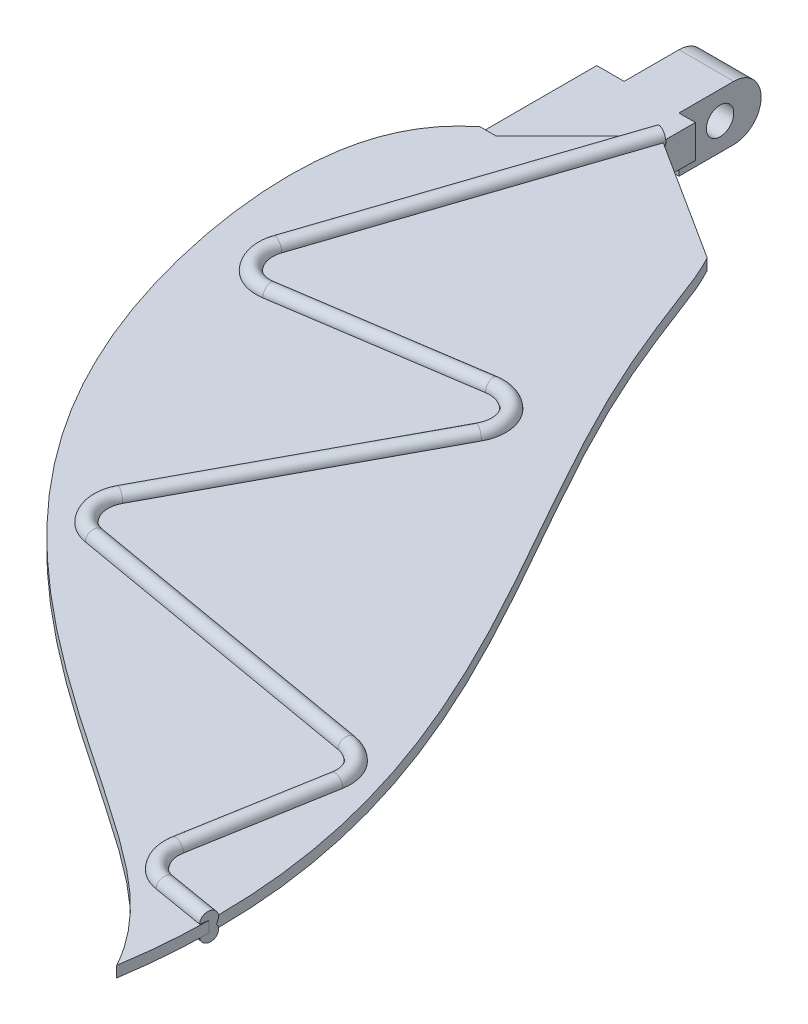
from build123d import *
from build123d.topology import SkipClean

# Parameters (mm, degrees)
SKETCH1_W           = 10
SKETCH1_H           = 15
BOSS_EXTRUDE1_DEPTH = 10
SKETCH2_R           = 2.5
CUT_EXTRUDE1_DEPTH  = 10
FILLET1_R           = 5
BOSS_EXTRUDE2_DEPTH = 6
CHAMFER1_SIZE       = 15
THICKEN2_START      = 9
THICKEN2_DEPTH      = 2
SWEEP1_PROFILE_R    = 1.5
SKETCH30_R          = 1
CUT_EXTRUDE2_DEPTH  = 6


# Read off the part's stored shape, not the designer's step: Thicken2
with BuildPart() as part:
    # Sketch1 → Boss-Extrude1 (new body)
    with BuildSketch(Plane(origin=(0, 0, 0), x_dir=(1, 0, 0), z_dir=(0, 1, 0))):
        Rectangle(SKETCH1_W, SKETCH1_H)
    extrude(amount=BOSS_EXTRUDE1_DEPTH)

    # Sketch2 → Cut-Extrude1 (cut)
    with BuildSketch(Plane(origin=(5, 0, 0), x_dir=(0, 0, -1), z_dir=(1, 0, 0))):
        with Locations((0, 5)):
            Circle(SKETCH2_R)
    extrude(amount=-CUT_EXTRUDE1_DEPTH, mode=Mode.SUBTRACT)

    # Fillet1
    fillet1_edges = [part.edges().sort_by_distance(p)[0] for p in [
        (0, 0, -7.5),
        (0, 10, -7.5),
    ]]
    fillet(fillet1_edges, radius=FILLET1_R - 0.0001)  # a hair under: the kernel refuses the full size

    # Sketch3 → Boss-Extrude2 (add)
    with BuildSketch(Plane(origin=(0, 10, 0), x_dir=(1, 0, 0), z_dir=(0, 1, 0))):
        Polygon((-5, -7.5), (-10, -7.5), (-10, -28.828934271), (7.994714039, -28.828934271), (7.994714039, -7.5), (5, -7.5), (0, -7.5), align=None)
    extrude(amount=-BOSS_EXTRUDE2_DEPTH)

    # Chamfer1
    chamfer1_edges = [part.edges().sort_by_distance(p)[0] for p in [
        (7.994714039, 7, 28.828934271),
    ]]
    chamfer(chamfer1_edges, length=CHAMFER1_SIZE)

    # Thicken2 outline → Thicken2 (add)
    with BuildSketch(Plane(origin=(0, 0, 0), x_dir=(1, 0, 0), z_dir=(0, 1, 0)).offset(THICKEN2_START)):
        with BuildLine():
            Line((-7.005285961, -28.828934271), (-10, -28.828934271))
            add(Edge.make_bspline(
                [(-10, -28.828934271), (-25.805548542, -41.548642671), (-25.805548542, -64.274187613), (-8.502642981, -101.403246954), (-13.322502729, -124.128791895), (10.043198408, -146.534258739), (71.49819318, -165.418866507), (71.49819318, -177.90191232), (81.740692308, -180.462537103), (89.422566655, -194.545973404)],
                knots=[0, 0, 0, 0, 0, 0, 0, 0, 0, 0, 1, 1, 1, 1, 1, 1, 1, 1, 1, 1], degree=9))
            add(Edge.make_bspline(
                [(89.422566655, -194.545973404), (100.945378174, -121.248089016), (40.770695794, -78.677702012), (40.770695794, -46.02973604), (31.488430959, -28.828934271)],
                knots=[0, 0, 0, 0, 0, 1, 1, 1, 1, 1], degree=4))
            Line((31.488430959, -28.828934271), (7.994714039, -13.828934271))
            Line((7.994714039, -13.828934271), (-7.005285961, -28.828934271))
        make_face()
    extrude(amount=THICKEN2_DEPTH)

    # Sweep1: sweep along a path in Sketch5
    with BuildLine(Plane.XZ.offset(-9)) as sweep1_path:
        Line((7.994714039, 13.828934271), (-9.559839963, 66.388364513))
        ThreePointArc((-9.559839963, 66.388364513), (-8.460678772, 72.151148401), (-2.971514318, 74.221633139))
        Line((-2.971514318, 74.221633139), (32.327359535, 68.882307682))
        ThreePointArc((32.327359535, 68.882307682), (38.128604445, 71.357676876), (38.510793347, 77.653375948))
        Line((38.510793347, 77.653375948), (15.633344245, 120.256788816))
        ThreePointArc((15.633344245, 120.256788816), (15.523828609, 125.719757641), (19.889062234, 129.006208229))
        Line((19.889062234, 129.006208229), (75.715709234, 138.737700667))
        ThreePointArc((75.715709234, 138.737700667), (79.593538333, 141.197528553), (80.596216607, 145.678928785))
        Line((80.596216607, 145.678928785), (76.278425981, 170.448795755))
        ThreePointArc((76.278425981, 170.448795755), (77.292173347, 174.94588542), (81.196785983, 177.396497454))
        Line((81.196785983, 177.396497454), (90.741777338, 178.997466082))
    # Sweep1 profile (on start of the path) → Sweep1 (sweep)
    with BuildSketch(Plane(origin=(7.994714039, 9, 13.828934271), x_dir=(0.9484950320892925, 0, 0.31679200447917233), z_dir=(-0.31679200447917233, 0, 0.9484950320892925))):
        Circle(SWEEP1_PROFILE_R)
    sweep1 = sweep(path=sweep1_path.line)

    # Mirror1: Sweep1 across plane
    with SkipClean():  # the faces are left unmerged after this step: merging them gives an invalid solid
        add(sweep1.mirror(Plane.ZX.offset(10)))

    # Sketch30 → Cut-Extrude2 (cut)
    with SkipClean():  # the faces are left unmerged after this step: merging them gives an invalid solid
        with BuildSketch(Plane.ZY.offset(10)):
            with Locations((25.5, 7)):
                Circle(SKETCH30_R)
        extrude(amount=-CUT_EXTRUDE2_DEPTH, mode=Mode.SUBTRACT)


solid = part.part
